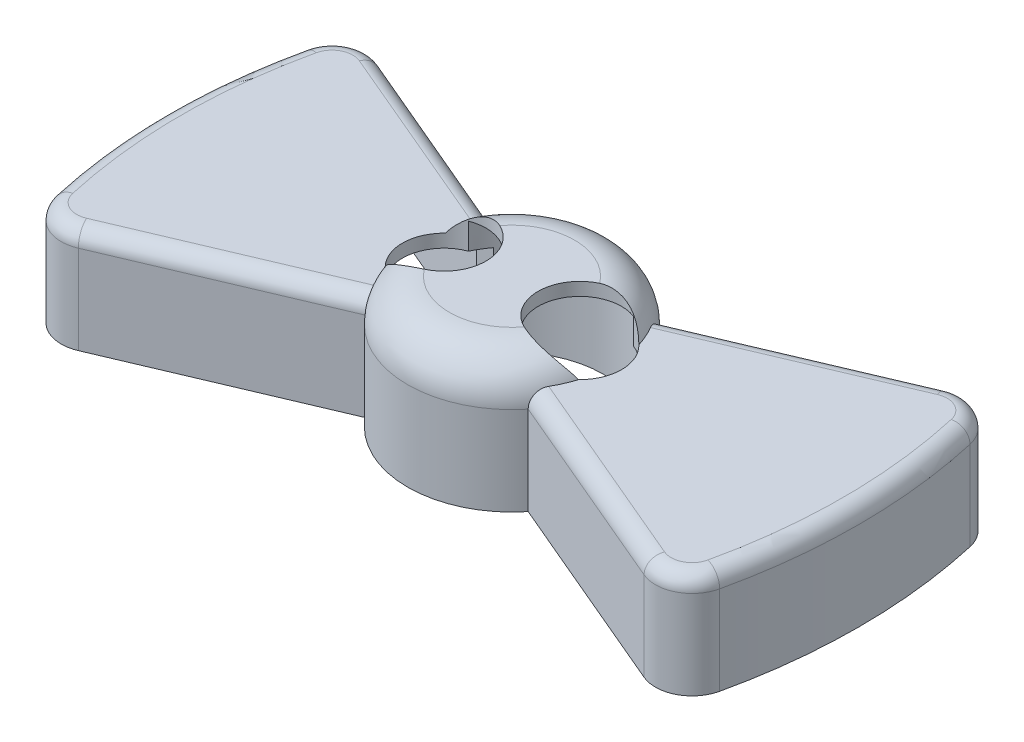
from build123d import *

# Parameters (mm, degrees)
BOSS_EXTRUDE3_DEPTH = 20
BOSS_EXTRUDE4_DEPTH = 25
SHELL2_T            = -2.5
CUT_EXTRUDE3_DEPTH  = 17.5
SKETCH2_11_R        = 8
CUT_EXTRUDE4_DEPTH  = 25
FILLET5_R           = 8
FILLET6_R           = 7
FILLET7_R           = 3


with BuildPart() as part:
    # Sketch2 → Boss-Extrude3 (new body)
    with BuildSketch(Plane(origin=(0, 0, 0), x_dir=(1, 0, 0), z_dir=(0, 1, 0))):
        with BuildLine():
            ThreePointArc((-17.0220445305489, 10.500000000000494), (-16.34484288252558, 11.525888735605292), (-15.605896556809459, 12.508236992404754))
            Line((-15.605896556809462, 12.508236992404749), (-61.6311392294316, 32.04479341686815))
            ThreePointArc((-61.6311392294316, 32.04479341686816), (-66.4294480667169, 3.55e-15), (-61.6311392294316, -32.04479341686815))
            Line((-61.6311392294316, -32.04479341686815), (-15.605896556809462, -12.508236992404749))
            ThreePointArc((-15.605896556809462, -12.508236992404749), (-16.34484288252558, -11.525888735605287), (-17.0220445305489, -10.500000000000488))
            Line((-17.022044530548726, -10.500000000000002), (-22.750000000000004, -10.500000000000002))
            Line((-22.750000000000004, -10.500000000000002), (-22.750000000000007, 10.499999999999998))
            Line((-22.750000000000007, 10.499999999999998), (-17.02204453054873, 10.499999999999998))
        make_face()
        with BuildLine():
            Line((61.6311392294316, 32.04479341686815), (15.605896556809462, 12.508236992404749))
            ThreePointArc((15.605896556809462, 12.508236992404749), (16.344842882525533, 11.525888735605356), (17.022044530548808, 10.500000000000638))
            Line((17.022044530548584, 10.499999999999998), (22.749999999999993, 10.499999999999998))
            Line((22.749999999999993, 10.499999999999998), (22.749999999999993, -10.500000000000002))
            Line((22.749999999999996, -10.500000000000002), (17.022044530548595, -10.500000000000002))
            ThreePointArc((17.02204453054881, -10.50000000000063), (16.344842882525537, -11.525888735605353), (15.605896556809462, -12.508236992404749))
            Line((15.605896556809462, -12.508236992404749), (61.6311392294316, -32.04479341686815))
            ThreePointArc((61.63113922943161, -32.04479341686816), (66.42944806671693, 3.55e-15), (61.63113922943161, 32.04479341686815))
        make_face()
        with BuildLine():
            ThreePointArc((-19.42307692307744, 4.769075679858371), (-18.446479144627922, 7.728350869804446), (-17.0220445305489, 10.500000000000494))
            Line((-17.02204453054873, 10.499999999999998), (-22.750000000000007, 10.499999999999998))
            Line((-22.750000000000007, 10.499999999999998), (-22.750000000000004, -10.500000000000002))
            Line((-22.750000000000004, -10.500000000000002), (-17.022044530548726, -10.500000000000002))
            ThreePointArc((-17.0220445305489, -10.500000000000488), (-18.446479144627325, -7.728350869805865), (-19.42307692307671, -4.769075679861351))
            ThreePointArc((-19.42307692307694, -4.769075679861458), (-21, -1.60941e-12), (-19.423076923077666, 4.769075679858474))
        make_face()
        with BuildLine():
            Line((22.749999999999993, 10.499999999999998), (17.022044530548584, 10.499999999999998))
            ThreePointArc((17.022044530548808, 10.500000000000638), (18.44647914462778, 7.728350869804789), (19.423076923077303, 4.769075679858921))
            ThreePointArc((19.423076923077325, 4.76907567985893), (20.595545253127604, 2.5115119565085973), (21, -1.00643e-12))
            ThreePointArc((21, -1.00838e-12), (20.595545253127412, -2.5115119565112023), (19.423076923076582, -4.769075679861943))
            ThreePointArc((19.423076923076565, -4.769075679861936), (18.44647914462718, -7.728350869806216), (17.02204453054881, -10.50000000000063))
            Line((17.022044530548595, -10.500000000000002), (22.749999999999996, -10.500000000000002))
            Line((22.749999999999993, -10.500000000000002), (22.749999999999993, 10.499999999999998))
        make_face()
    extrude(amount=BOSS_EXTRUDE3_DEPTH)

    # Sketch2<8> → Boss-Extrude4 (add)
    with BuildSketch(Plane(origin=(0, 0, 0), x_dir=(1, 0, 0), z_dir=(0, 1, 0))):
        with BuildLine():
            ThreePointArc((19.423076923076586, -4.769075679861939), (21, -1.62771e-12), (19.423076923077325, 4.76907567985893))
            ThreePointArc((19.423076923077307, 4.769075679858921), (-2.8333e-13, 20.000000000000004), (-19.423076923077446, 4.769075679858371))
            ThreePointArc((-19.423076923077666, 4.769075679858474), (-21, -1.60941e-12), (-19.42307692307694, -4.769075679861458))
            ThreePointArc((-19.423076923077307, -4.7690756798589184), (-1.55786e-12, -20), (19.423076923076565, -4.769075679861944))
        make_face()
    extrude(amount=BOSS_EXTRUDE4_DEPTH)

    # Shell2
    shell2_openings = [part.faces().sort_by_distance(p)[0] for p in [
        (0, 0, 0),
    ]]
    offset(amount=SHELL2_T, openings=shell2_openings, kind=Kind.INTERSECTION)

    # Sketch2<10> → Cut-Extrude3 (cut)
    with BuildSketch(Plane(origin=(0, 0, 0), x_dir=(1, 0, 0), z_dir=(0, 1, 0))):
        Polygon((-22.750000000000007, 10.499999999999998), (22.749999999999993, 10.499999999999998), (22.749999999999993, -10.500000000000002), (-22.750000000000004, -10.500000000000002), align=None)
    extrude(amount=CUT_EXTRUDE3_DEPTH, mode=Mode.SUBTRACT)

    # Sketch2<11> → Cut-Extrude4 (cut)
    with BuildSketch(Plane(origin=(0, 0, 0), x_dir=(1, 0, 0), z_dir=(0, 1, 0))):
        with Locations(Location((-13, -1.00643e-12, 0), (0, 0, 110.619699309))):
            Circle(SKETCH2_11_R)
        with Locations(Location((13, -1.00643e-12, 0), (0, 0, 69.380300691))):
            Circle(SKETCH2_11_R)
    extrude(amount=CUT_EXTRUDE4_DEPTH, mode=Mode.SUBTRACT)

    # Fillet5
    # the kernel refuses this fillet: 8 mm, written as the material it takes off along each edge
    with BuildSketch(Plane(origin=(-3.55e-15, 25, -2.66e-15), x_dir=(0.7245747192031462, 0, 0.6891962538288221), z_dir=(-0.6891962538288221, 0, 0.7245747192031462))) as fillet5_piece_1_section:
        with BuildLine():
            CenterArc((20.000000000000004 - FILLET5_R, -FILLET5_R), FILLET5_R, 0, 89.99999999999997)
            Line((20.000000000000004 - FILLET5_R, 0), (20.000000000000004, 0))
            Line((20.000000000000004, 0), (20.000000000000004, -FILLET5_R))
        make_face()
    fillet5_piece_1 = revolve(axis=Axis((-3.55e-15, 25, -2.66e-15), (0, 1, 0)), revolution_arc=267.1330380487347, mode=Mode.PRIVATE)
    fillet5_piece_1 = split(fillet5_piece_1, bisect_by=Plane(origin=(15.376883800116238, 17.250173553546436, 12.411026844597739), z_dir=(-0.39073112848926816, 0, 0.9205048534524428)), keep=Keep.TOP, mode=Mode.PRIVATE)
    fillet5_piece_1 = split(fillet5_piece_1, bisect_by=Plane(origin=(10.14551190142619, 17.250173553546436, 1.5774126199568954), z_dir=(0.39073112848926816, 0, 0.9205048534524428)), keep=Keep.TOP, mode=Mode.PRIVATE)
    add(fillet5_piece_1, mode=Mode.SUBTRACT)
    with BuildSketch(Plane(origin=(-3.55e-15, 25, -2.66e-15), x_dir=(0.7245747192031462, 0, 0.6891962538288221), z_dir=(-0.6891962538288221, 0, 0.7245747192031462))) as fillet5_piece_2_section:
        with BuildLine():
            CenterArc((20.000000000000004 - FILLET5_R, -FILLET5_R), FILLET5_R, 0, 89.99999999999997)
            Line((20.000000000000004 - FILLET5_R, 0), (20.000000000000004, 0))
            Line((20.000000000000004, 0), (20.000000000000004, -FILLET5_R))
        make_face()
    fillet5_piece_2 = revolve(axis=Axis((-3.55e-15, 25, -2.66e-15), (0, 1, 0)), revolution_arc=267.1330380487347, mode=Mode.PRIVATE)
    fillet5_piece_2 = split(fillet5_piece_2, bisect_by=Plane(origin=(15.025377998879783, 20, 11.2684122949076), z_dir=(0, 1, 0)), keep=Keep.TOP, mode=Mode.PRIVATE)
    add(fillet5_piece_2, mode=Mode.SUBTRACT)
    with BuildSketch(Plane(origin=(-3.55e-15, 25, -2.66e-15), x_dir=(0.7245747192031462, 0, 0.6891962538288221), z_dir=(-0.6891962538288221, 0, 0.7245747192031462))) as fillet5_piece_3_section:
        with BuildLine():
            CenterArc((20.000000000000004 - FILLET5_R, -FILLET5_R), FILLET5_R, 0, 89.99999999999997)
            Line((20.000000000000004 - FILLET5_R, 0), (20.000000000000004, 0))
            Line((20.000000000000004, 0), (20.000000000000004, -FILLET5_R))
        make_face()
    fillet5_piece_3 = revolve(axis=Axis((-3.55e-15, 25, -2.66e-15), (0, 1, 0)), revolution_arc=267.1330380487347, mode=Mode.PRIVATE)
    fillet5_piece_3 = split(fillet5_piece_3, bisect_by=Plane(origin=(5.075882990188511, 17.250136461970325, -8.038511419028751), z_dir=(-0.39073112848926816, 0, -0.9205048534524428)), keep=Keep.TOP, mode=Mode.PRIVATE)
    fillet5_piece_3 = split(fillet5_piece_3, bisect_by=Plane(origin=(-5.075882990188514, 17.250136461970325, -8.038511419028755), z_dir=(0.39073112848926816, 0, -0.9205048534524428)), keep=Keep.TOP, mode=Mode.PRIVATE)
    add(fillet5_piece_3, mode=Mode.SUBTRACT)
    with BuildSketch(Plane(origin=(0, 25, -1.78e-15), x_dir=(-0.7245747192031464, 0, -0.6891962538288215), z_dir=(0.6891962538288215, 0, -0.7245747192031464))) as fillet5_piece_4_section:
        with BuildLine():
            CenterArc((20.000000000000004 - FILLET5_R, -FILLET5_R), FILLET5_R, 0, 90)
            Line((20.000000000000007, -FILLET5_R), (20.000000000000004, 0))
            Line((20.000000000000004, 0), (20.000000000000004 - FILLET5_R, 0))
        make_face()
    fillet5_piece_4 = revolve(axis=Axis((0, 25, -1.78e-15), (0, 1, 0)), revolution_arc=267.13303804872413, mode=Mode.PRIVATE)
    fillet5_piece_4 = split(fillet5_piece_4, bisect_by=Plane(origin=(-16.28359366464209, 20, -8.517555369890019), z_dir=(0, 1, 0)), keep=Keep.TOP, mode=Mode.PRIVATE)
    add(fillet5_piece_4, mode=Mode.SUBTRACT)
    with BuildSketch(Plane(origin=(0, 25, -1.78e-15), x_dir=(-0.7245747192031464, 0, -0.6891962538288215), z_dir=(0.6891962538288215, 0, -0.7245747192031464))) as fillet5_piece_5_section:
        with BuildLine():
            CenterArc((20.000000000000004 - FILLET5_R, -FILLET5_R), FILLET5_R, 0, 90)
            Line((20.000000000000007, -FILLET5_R), (20.000000000000004, 0))
            Line((20.000000000000004, 0), (20.000000000000004 - FILLET5_R, 0))
        make_face()
    fillet5_piece_5 = revolve(axis=Axis((0, 25, -1.78e-15), (0, 1, 0)), revolution_arc=267.13303804872413, mode=Mode.PRIVATE)
    fillet5_piece_5 = split(fillet5_piece_5, bisect_by=Plane(origin=(-10.05571260083336, 19.254610903703146, -1.6155301615717867), z_dir=(-0.39073112848926816, 0, -0.9205048534524428)), keep=Keep.TOP, mode=Mode.PRIVATE)
    fillet5_piece_5 = split(fillet5_piece_5, bisect_by=Plane(origin=(-15.217709403840237, 19.254610903703146, -12.34346132199321), z_dir=(0.39073112848926816, 0, -0.9205048534524428)), keep=Keep.TOP, mode=Mode.PRIVATE)
    add(fillet5_piece_5, mode=Mode.SUBTRACT)
    with BuildSketch(Plane(origin=(0, 25, -1.78e-15), x_dir=(-0.7245747192031464, 0, -0.6891962538288215), z_dir=(0.6891962538288215, 0, -0.7245747192031464))) as fillet5_piece_6_section:
        with BuildLine():
            CenterArc((20.000000000000004 - FILLET5_R, -FILLET5_R), FILLET5_R, 0, 90)
            Line((20.000000000000007, -FILLET5_R), (20.000000000000004, 0))
            Line((20.000000000000004, 0), (20.000000000000004 - FILLET5_R, 0))
        make_face()
    fillet5_piece_6 = revolve(axis=Axis((0, 25, -1.78e-15), (0, 1, 0)), revolution_arc=267.13303804872413, mode=Mode.PRIVATE)
    fillet5_piece_6 = split(fillet5_piece_6, bisect_by=Plane(origin=(5.015141087805221, 18.778949157584005, 8.012728011178384), z_dir=(-0.39073112848926816, 0, 0.9205048534524428)), keep=Keep.TOP, mode=Mode.PRIVATE)
    fillet5_piece_6 = split(fillet5_piece_6, bisect_by=Plane(origin=(-5.015141087805212, 18.778949157584005, 8.012728011178378), z_dir=(0.39073112848926816, 0, 0.9205048534524428)), keep=Keep.TOP, mode=Mode.PRIVATE)
    add(fillet5_piece_6, mode=Mode.SUBTRACT)

    # Fillet6
    fillet6_edges = [part.edges().sort_by_distance(p)[0] for p in [
        (-61.63113922943161, 10, 32.04479341686816),
        (-61.631139229431604, 10, -32.04479341686816),
        (61.63113922943161, 10, 32.04479341686816),
        (61.63113922943161, 10, -32.04479341686816),
        (-60.02016642933438, 8.75, -28.645075090114986),
        (-60.020166429334374, 8.75, 28.645075090114982),
        (60.020166429334374, 8.75, 28.645075090114993),
        (60.020166429334374, 8.75, -28.64507509011499),
    ]]
    fillet(fillet6_edges, radius=FILLET6_R)

    # Fillet7
    fillet7_edges = [part.edges().sort_by_distance(p)[0] for p in [
        (-34.62523517363144, 20.000000000065988, -20.581467256158437),
        (66.42944806671696, 20, -1.78e-15),
        (60.13486704638824, 20, 28.6760855140247),
        (60.13486704638824, 20, -28.6760855140247),
        (-66.42944806671692, 20, 3.55e-15),
        (-60.13486704638822, 20, 28.676085514024674),
        (-60.13486704638822, 20, -28.676085514024678),
        (-34.6252351775259, 20.000000001642313, 20.58146725663078),
        (34.62523517363144, 20.000000000065985, -20.581467256158437),
        (34.625235177524246, 20.000000001644384, 20.58146725663181),
    ]]
    fillet(fillet7_edges, radius=FILLET7_R)


solid = part.part
